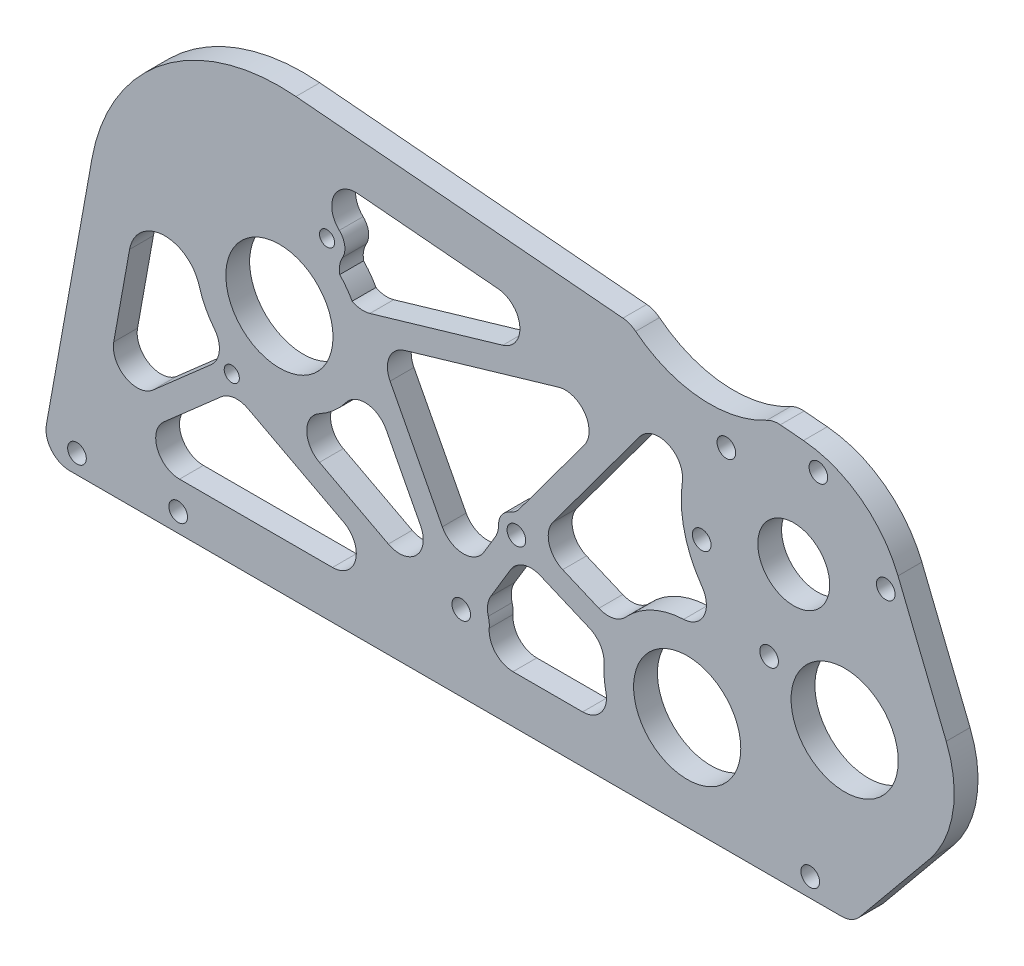
from build123d import *

# Parameters (mm, degrees)
SKETCH7_R           = 2.4892
SKETCH7_R_2         = 14.2875
SKETCH7_R_3         = 9.5885
BOSS_EXTRUDE1_DEPTH = 6.35
FILLET1_R           = 6.35
SKETCH8_R           = 2.0193
CUT_EXTRUDE1_DEPTH  = 430.18373998
CUT_EXTRUDE2_DEPTH  = 430.18373998
FILLET2_R           = 6.35
CUT_EXTRUDE3_DEPTH  = 430.18373998
FILLET3_R           = 6.35


with BuildPart() as part:
    # Sketch7 → Boss-Extrude1 (new body)
    with BuildSketch(Plane.XY):
        with BuildLine():
            Line((156.802886499, 271.334839055), (292.124574609, 259.562072781))
            ThreePointArc((292.124574609, 259.562072781), (307.359456371, 253.797346157), (317.335460257, 240.92050486))
            Line((317.335460257, 240.92050486), (330.183878881, 209.138399201))
            ThreePointArc((330.183878881, 209.138399201), (331.977050105, 193.772568701), (325.671250521, 179.645959002))
            Line((325.671250521, 179.645959002), (305.223881116, 154.7622))
            Line((305.223881116, 154.7622), (88.913712344, 154.7622))
            Line((88.913712344, 154.7622), (102.403069007, 229.723049032))
            ThreePointArc((102.403069007, 229.723049032), (121.535951488, 261.075107914), (156.802886499, 271.334839055))
        make_face()
        with Locations((314.05918612, 236.251557065)):
            Circle(SKETCH7_R, mode=Mode.SUBTRACT)
        with Locations((271.56415789, 247.638065561)):
            Circle(SKETCH7_R, mode=Mode.SUBTRACT)
        with Locations((215.588385064, 199.44728721)):
            Circle(SKETCH7_R, mode=Mode.SUBTRACT)
        with Locations((200.87775722, 174.949776042)):
            Circle(SKETCH7_R, mode=Mode.SUBTRACT)
        with Locations((125.4125, 159.766)):
            Circle(SKETCH7_R, mode=Mode.SUBTRACT)
        with Locations((98.425, 159.766)):
            Circle(SKETCH7_R, mode=Mode.SUBTRACT)
        with Locations((261.120439119, 180.086)):
            Circle(SKETCH7_R_2, mode=Mode.SUBTRACT)
        with Locations((289.524670132, 229.677553319)):
            Circle(SKETCH7_R_3, mode=Mode.SUBTRACT)
        with Locations((152.4, 220.726)):
            Circle(SKETCH7_R_2, mode=Mode.SUBTRACT)
        with Locations((282.950666386, 205.143037331)):
            Circle(SKETCH7_R, mode=Mode.SUBTRACT)
        with Locations((293.921250521, 159.766)):
            Circle(SKETCH7_R, mode=Mode.SUBTRACT)
        with Locations((296.098673877, 254.212069307)):
            Circle(SKETCH7_R, mode=Mode.SUBTRACT)
        with Locations((264.990154144, 223.103549573)):
            Circle(SKETCH7_R, mode=Mode.SUBTRACT)
        with Locations((303.10309256, 198.190563238)):
            Circle(SKETCH7_R_2, mode=Mode.SUBTRACT)
    extrude(amount=BOSS_EXTRUDE1_DEPTH)

    # Fillet1
    fillet1_edges = [part.edges().sort_by_distance(p)[0] for p in [
        (88.913712344, 154.7622, 3.175),
        (305.223881116, 154.7622, 3.175),
    ]]
    fillet(fillet1_edges, radius=FILLET1_R)

    # Sketch8 → Cut-Extrude1 (cut, through all)
    with BuildSketch(Plane.XY.offset(6.35)):
        with Locations((139.7, 198.728954744)):
            Circle(SKETCH8_R)
        with Locations((165.1, 242.723045256)):
            Circle(SKETCH8_R)
    extrude(amount=-CUT_EXTRUDE1_DEPTH, mode=Mode.SUBTRACT)

    # Sketch9 → Cut-Extrude2 (cut, through all)
    with BuildSketch(Plane.XY.offset(6.35)):
        Polygon((192.215699939, 167.4622), (140.153176876, 194.901142091), (108.914200542, 167.4622), align=None)
        with BuildLine():
            Line((105.006311995, 172.481409229), (139.405190931, 202.695870709))
            ThreePointArc((139.405190931, 202.695870709), (134.178706704, 208.000627879), (130.997954718, 214.734081882))
            ThreePointArc((130.997954718, 214.734081882), (121.373696789, 221.680388553), (112.451225035, 213.853063668))
            Line((112.451225035, 213.853063668), (105.006311995, 172.481409229))
        make_face()
        with BuildLine():
            Line((142.856634161, 200.654258833), (199.446859608, 170.829044311))
            Line((199.446859608, 170.829044311), (174.522172529, 218.590559159))
            ThreePointArc((174.522172529, 218.590559159), (163.353735061, 201.387791365), (142.856634161, 200.654258833))
        make_face()
        with BuildLine():
            ThreePointArc((207.090659293, 179.1287284), (207.486615614, 171.430289472), (200.87775722, 167.4622))
            Line((200.87775722, 167.4622), (242.828629516, 167.4622))
            ThreePointArc((242.828629516, 167.4622), (239.225976426, 176.267213756), (239.635081351, 185.771949927))
            Line((239.635081351, 185.771949927), (216.888173338, 195.444463683))
            Line((216.888173338, 195.444463683), (207.090659293, 179.1287284))
        make_face()
        with BuildLine():
            Line((201.071895945, 181.440426311), (211.038996943, 198.038573623))
            ThreePointArc((211.038996943, 198.038573623), (211.626722178, 202.09051127), (215.142476173, 204.18886622))
            Line((215.142476173, 204.18886622), (244.915304173, 244.515886695))
            Line((244.915304173, 244.515886695), (178.332964337, 225.013523786))
            Line((178.332964337, 225.013523786), (201.071895945, 181.440426311))
        make_face()
        with BuildLine():
            Line((220.530573454, 200.795877243), (242.119929287, 191.615581567))
            ThreePointArc((242.119929287, 191.615581567), (249.803324005, 199.213820851), (260.162035863, 202.290325889))
            ThreePointArc((260.162035863, 202.290325889), (265.591847998, 205.843187716), (265.065785636, 212.310717798))
            ThreePointArc((265.065785636, 212.310717798), (260.371050176, 222.612820471), (259.82895894, 233.921224319))
            ThreePointArc((259.82895894, 233.921224319), (255.950865737, 240.695243706), (248.434239374, 238.591134948))
            Line((248.434239374, 238.591134948), (220.530573454, 200.795877243))
        make_face()
        with BuildLine():
            Line((244.358726731, 250.969652931), (173.250883763, 257.155919354))
            ThreePointArc((173.250883763, 257.155919354), (166.902355325, 253.418974991), (168.357366979, 246.19737492))
            ThreePointArc((168.357366979, 246.19737492), (169.810117104, 243.42746212), (169.231308719, 240.353721614))
            ThreePointArc((169.231308719, 240.353721614), (168.481376233, 238.26962528), (168.492868178, 236.05473833))
            ThreePointArc((168.492868178, 236.05473833), (170.28939148, 233.913884496), (171.803033097, 231.564493051))
            ThreePointArc((171.803033097, 231.564493051), (174.118910026, 230.875043173), (176.524679196, 231.100657401))
            Line((176.524679196, 231.100657401), (244.358726731, 250.969652931))
        make_face()
    extrude(amount=-CUT_EXTRUDE2_DEPTH, mode=Mode.SUBTRACT)

    # Fillet2
    fillet2_edges = [part.edges().sort_by_distance(p)[0] for p in [
        (211.038996943, 198.038573623, 3.175),
        (201.071895945, 181.440426311, 3.175),
        (178.332964337, 225.013523786, 3.175),
        (244.915304173, 244.515886695, 3.175),
        (215.142476173, 204.18886622, 3.175),
        (174.522172529, 218.590559159, 3.175),
        (199.446859608, 170.829044311, 3.175),
        (142.856634161, 200.654258833, 3.175),
        (242.828629516, 167.4622, 3.175),
        (200.87775722, 167.4622, 3.175),
        (207.090659293, 179.1287284, 3.175),
        (216.888173338, 195.444463683, 3.175),
        (239.635081351, 185.771949927, 3.175),
        (192.215699939, 167.4622, 3.175),
        (108.914200542, 167.4622, 3.175),
        (140.153176876, 194.901142091, 3.175),
        (242.119929287, 191.615581567, 3.175),
        (220.530573454, 200.795877243, 3.175),
        (139.405190931, 202.695870709, 3.175),
        (244.358726731, 250.969652931, 3.175),
        (105.006311995, 172.481409229, 3.175),
    ]]
    fillet(fillet2_edges, radius=FILLET2_R)

    # Sketch10 → Cut-Extrude3 (cut, through all)
    with BuildSketch(Plane.XY.offset(6.35)):
        with BuildLine():
            Line((283.93856884, 260.274241938), (245.981939549, 263.576406813))
            ThreePointArc((245.981939549, 263.576406813), (264.409893382, 255.599219494), (283.93856884, 260.274241938))
        make_face()
    extrude(amount=-CUT_EXTRUDE3_DEPTH, mode=Mode.SUBTRACT)

    # Fillet3
    fillet3_edges = [part.edges().sort_by_distance(p)[0] for p in [
        (283.93856884, 260.274241938, 3.175),
        (245.981939549, 263.576406813, 3.175),
    ]]
    fillet(fillet3_edges, radius=FILLET3_R)


solid = part.part
